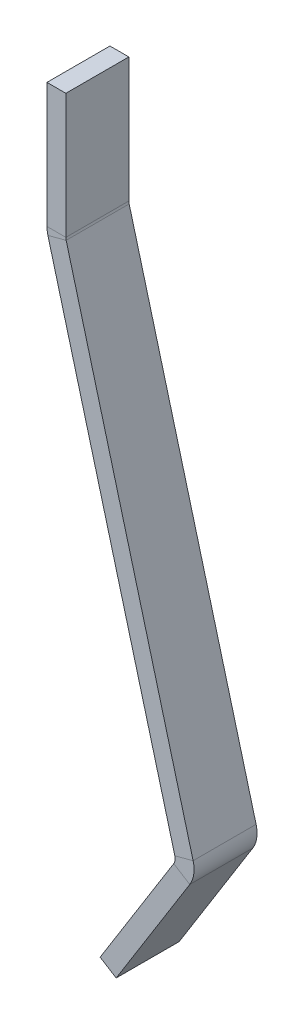
from build123d import *

# Parameters (mm, degrees)
BASE_FLANGE1_DEPTH      = 2.5
BASE_FLANGE1_DEPTH_BACK = 2.5


# Sheet-metal steps are written as plain solids
with BuildPart() as part:
    # Sketch1 → Base-Flange1 (new, two sides: drawn at the far end of the back side and taken through both)
    with BuildSketch(Plane.XY.offset(-BASE_FLANGE1_DEPTH_BACK)):
        with BuildLine():
            Line((0, 39.604011434), (0, 29.700986664))
            ThreePointArc((0, 29.700986664), (0.006301715, 29.60484107), (0.025099036, 29.510340555))
            Line((0.025099036, 29.510340555), (10.101059931, -8.09365744))
            ThreePointArc((10.101059931, -8.09365744), (10.152703108, -9.003122645), (9.8374146, -9.857749543))
            Line((9.8374146, -9.857749543), (3.993730633, -19.209598772))
            Line((3.993730633, -19.209598772), (2.721658489, -18.414719875))
            Line((2.721658489, -18.414719875), (8.565342456, -9.062870646))
            ThreePointArc((8.565342456, -9.062870646), (8.669179313, -8.781408529), (8.652171192, -8.481886008))
            Line((8.652171192, -8.481886008), (-1.423789703, 29.122111987))
            ThreePointArc((-1.423789703, 29.122111987), (-1.480865577, 29.409051782), (-1.5, 29.700986664))
            Line((-1.5, 29.700986664), (-1.5, 39.604011434))
            Line((-1.5, 39.604011434), (0, 39.604011434))
        make_face()
    extrude(amount=BASE_FLANGE1_DEPTH + BASE_FLANGE1_DEPTH_BACK)


solid = part.part
